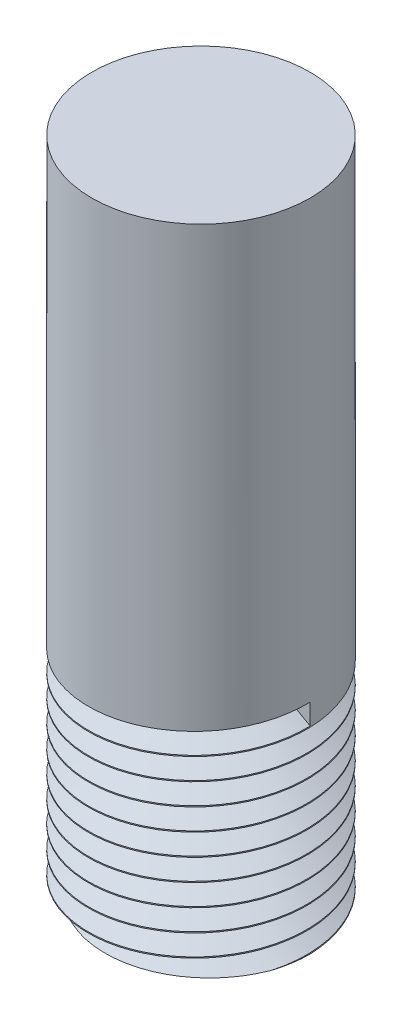
from build123d import *

# Parameters (mm, degrees)
SKETCH1_R           = 5
BOSS_EXTRUDE1_DEPTH = 30
CUT_SWEEP1_PITCH    = 1


with BuildPart() as part:
    # Sketch1 → Boss-Extrude1 (new body)
    with BuildSketch(Plane(origin=(0, 0, 0), x_dir=(1, 0, 0), z_dir=(0, 1, 0))):
        with Locations(Location((0, 0, 0), (0, 0, 270))):
            Circle(SKETCH1_R)
    extrude(amount=BOSS_EXTRUDE1_DEPTH)

    # Cut-Sweep1: the profile of Sketch3 profile screwed along a right-hand helix of 10 turns, 8 arcs to a turn; built about Z, then put on its axis
    cut_sweep1_z = Axis((0, 0, 0), (0, 0, 1))
    cut_sweep1_corners = [(5.0003, 0, -0.950173205), (5.0003, 0, 0.000173205), (4.177275866, 0, -0.475)]
    with BuildLine(mode=Mode.PRIVATE) as cut_sweep1_profile:
        Line(cut_sweep1_corners[0], cut_sweep1_corners[1])
        Line(cut_sweep1_corners[1], cut_sweep1_corners[2])
        Line(cut_sweep1_corners[2], cut_sweep1_corners[0])
    cut_sweep1_cap = Face(cut_sweep1_profile.wire())
    cut_sweep1_turn_angles = [0, 22.5, 45, 67.5, 90, 112.5, 135, 157.5, 180, 202.5, 225, 247.5, 270, 292.5, 315, 337.5, 360]
    cut_sweep1_turn_weights = [1, 0.9238795325112867, 1, 0.9238795325112867, 1, 0.9238795325112867, 1, 0.9238795325112867, 1, 0.9238795325112867, 1, 0.9238795325112867, 1, 0.9238795325112867, 1, 0.9238795325112867, 1]
    cut_sweep1_turn_rails = [Edge.make_bspline([Vector(p[0], p[1], 0).rotate(cut_sweep1_z, cut_sweep1_turn_angles[k]) / cut_sweep1_turn_weights[k] + Vector(0, 0, p[2] + CUT_SWEEP1_PITCH * cut_sweep1_turn_angles[k] / 360) for k in range(17)], [0, 0, 0, 1, 1, 2, 2, 3, 3, 4, 4, 5, 5, 6, 6, 7, 7, 8, 8, 8], 2, cut_sweep1_turn_weights) for p in cut_sweep1_corners]
    cut_sweep1_turn_sides = [Face.make_surface_from_curves(cut_sweep1_turn_rails[p[0]], cut_sweep1_turn_rails[p[1]]) for p in [(0, 1), (1, 2), (2, 0)]]
    cut_sweep1 = Plane(origin=(0, 0, 0), x_dir=(1, 0, 0), z_dir=(0, 1, 0)) * Solid(Shell([*[p.moved(Location((0, 0, CUT_SWEEP1_PITCH * i))) for i in range(10) for p in cut_sweep1_turn_sides], cut_sweep1_cap, cut_sweep1_cap.rotate(cut_sweep1_z, 3600).moved(Location((0, 0, CUT_SWEEP1_PITCH * 3600 / 360)))]))
    add(cut_sweep1, mode=Mode.SUBTRACT)


solid = part.part
